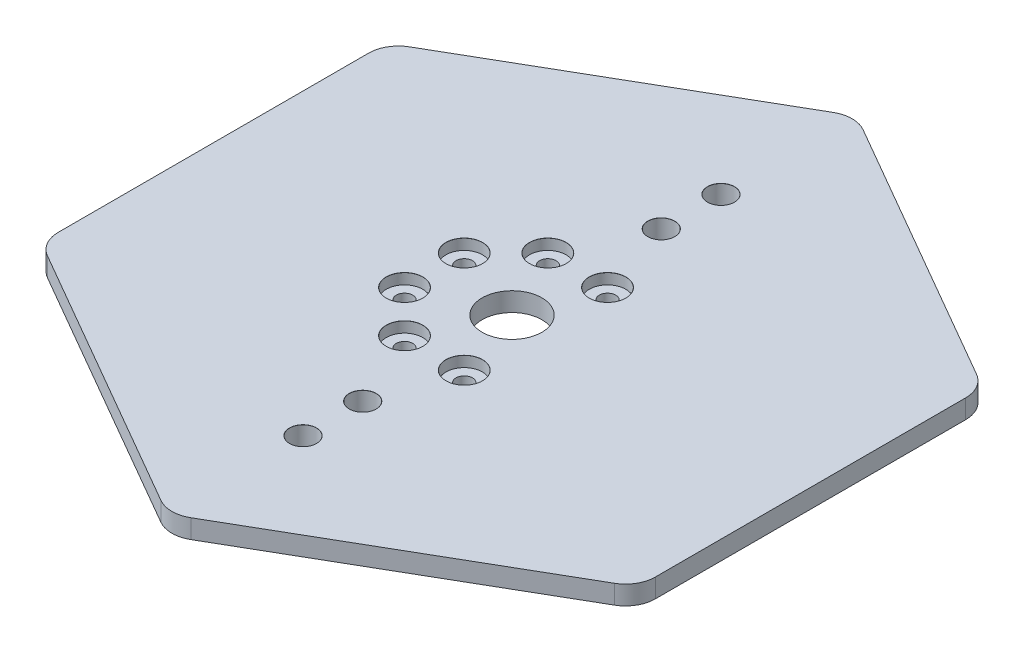
from build123d import *

# Parameters (mm, degrees)
BOSS_EXTRUDE1_DEPTH                    = 6.35
SKETCH2_R                              = 10
CUT_EXTRUDE1_DEPTH                     = 153.884452556
M8_CLEARANCE_HOLE1_D                   = 9
M8_CLEARANCE_HOLE1_CSINK_D             = 9.05
M8_CLEARANCE_HOLE1_CSINK_ANGLE         = 90
CBORE_FOR_M5_HEX_HEAD_BOLT1_AT_2_COUNT = 2
CBORE_FOR_M5_HEX_HEAD_BOLT1_AT_2_PITCH = 19.798989873
CBORE_FOR_M5_HEX_HEAD_BOLT1_AT_3_COUNT = 2
CBORE_FOR_M5_HEX_HEAD_BOLT1_AT_3_PITCH = 36.769552622
CBORE_FOR_M5_HEX_HEAD_BOLT1_AT_4_COUNT = 2
CBORE_FOR_M5_HEX_HEAD_BOLT1_AT_4_PITCH = 20
CBORE_FOR_M5_HEX_HEAD_BOLT1_AT_5_COUNT = 2
CBORE_FOR_M5_HEX_HEAD_BOLT1_AT_5_PITCH = 36.769552622
CBORE_FOR_M5_HEX_HEAD_BOLT1_AT_6_COUNT = 2
CBORE_FOR_M5_HEX_HEAD_BOLT1_AT_6_PITCH = 48.083261121
FILLET1_R                              = 10


with BuildPart() as part:
    # Sketch1 → Boss-Extrude1 (new body)
    with BuildSketch(Plane(origin=(0, 0, 0), x_dir=(1, 0, 0), z_dir=(0, 1, 0))):
        Polygon((100, 57.735026919), (0, 115.470053838), (-100, 57.735026919), (-100, -57.735026919), (0, -115.470053838), (100, -57.735026919), align=None)
    extrude(amount=BOSS_EXTRUDE1_DEPTH)

    # Sketch2 → Cut-Extrude1 (cut, through all)
    with BuildSketch(Plane(origin=(0, 6.35, 0), x_dir=(1, 0, 0), z_dir=(0, 1, 0))):
        Circle(SKETCH2_R)
    extrude(amount=-CUT_EXTRUDE1_DEPTH, mode=Mode.SUBTRACT)

    # M8 Clearance Hole1 (through all)
    with Locations(Plane(origin=(0, 6.35, 0), x_dir=(1, 0, 0), z_dir=(0, 1, 0))):
        with Locations((0, 70), (0, 50), (0, -50), (0, -70)):
            CounterSinkHole(M8_CLEARANCE_HOLE1_D / 2, M8_CLEARANCE_HOLE1_CSINK_D / 2, counter_sink_angle=M8_CLEARANCE_HOLE1_CSINK_ANGLE)

    # Sketch8 → CBORE for M5 Hex Head Bolt1 (revolve, cut)
    with BuildSketch(Plane(origin=(-26, 6.35, -10), x_dir=(0, 0, 1), z_dir=(1, 0, 0))):
        Polygon((0, 0), (0, 6.35), (2.75, 6.35), (2.75, 3.58), (6.12, 3.58), (6.12, 0.025), (6.145, 0), align=None)
    cbore_for_m5_hex_head_bolt1 = revolve(axis=Axis((-26, 12.7, -10), (0, -1, 0)), mode=Mode.SUBTRACT)

    # CBORE for M5 Hex Head Bolt1 at 2: CBORE for M5 Hex Head Bolt1 ×2
    with Locations(*[Vector(0.7071067811865476, 0, -0.7071067811865476) * (i * CBORE_FOR_M5_HEX_HEAD_BOLT1_AT_2_PITCH) for i in range(1, CBORE_FOR_M5_HEX_HEAD_BOLT1_AT_2_COUNT)]):
        add(cbore_for_m5_hex_head_bolt1, mode=Mode.SUBTRACT)

    # CBORE for M5 Hex Head Bolt1 at 3: CBORE for M5 Hex Head Bolt1 ×2
    with Locations(*[Vector(0.924678098474716, 0, -0.38074980525429486) * (i * CBORE_FOR_M5_HEX_HEAD_BOLT1_AT_3_PITCH) for i in range(1, CBORE_FOR_M5_HEX_HEAD_BOLT1_AT_3_COUNT)]):
        add(cbore_for_m5_hex_head_bolt1, mode=Mode.SUBTRACT)

    # CBORE for M5 Hex Head Bolt1 at 4: CBORE for M5 Hex Head Bolt1 ×2
    with Locations(*[(0, 0, i * CBORE_FOR_M5_HEX_HEAD_BOLT1_AT_4_PITCH) for i in range(1, CBORE_FOR_M5_HEX_HEAD_BOLT1_AT_4_COUNT)]):
        add(cbore_for_m5_hex_head_bolt1, mode=Mode.SUBTRACT)

    # CBORE for M5 Hex Head Bolt1 at 5: CBORE for M5 Hex Head Bolt1 ×2
    with Locations(*[Vector(0.38074980525429486, 0, 0.924678098474716) * (i * CBORE_FOR_M5_HEX_HEAD_BOLT1_AT_5_PITCH) for i in range(1, CBORE_FOR_M5_HEX_HEAD_BOLT1_AT_5_COUNT)]):
        add(cbore_for_m5_hex_head_bolt1, mode=Mode.SUBTRACT)

    # CBORE for M5 Hex Head Bolt1 at 6: CBORE for M5 Hex Head Bolt1 ×2
    with Locations(*[Vector(0.7071067811865476, 0, 0.7071067811865476) * (i * CBORE_FOR_M5_HEX_HEAD_BOLT1_AT_6_PITCH) for i in range(1, CBORE_FOR_M5_HEX_HEAD_BOLT1_AT_6_COUNT)]):
        add(cbore_for_m5_hex_head_bolt1, mode=Mode.SUBTRACT)

    # Fillet1
    fillet1_edges = [part.edges().sort_by_distance(p)[0] for p in [
        (0, 3.175, -115.470053838),
        (-100, 3.175, -57.735026919),
        (-100, 3.175, 57.735026919),
        (100, 3.175, -57.735026919),
        (100, 3.175, 57.735026919),
        (0, 3.175, 115.470053838),
    ]]
    fillet(fillet1_edges, radius=FILLET1_R)


solid = part.part
